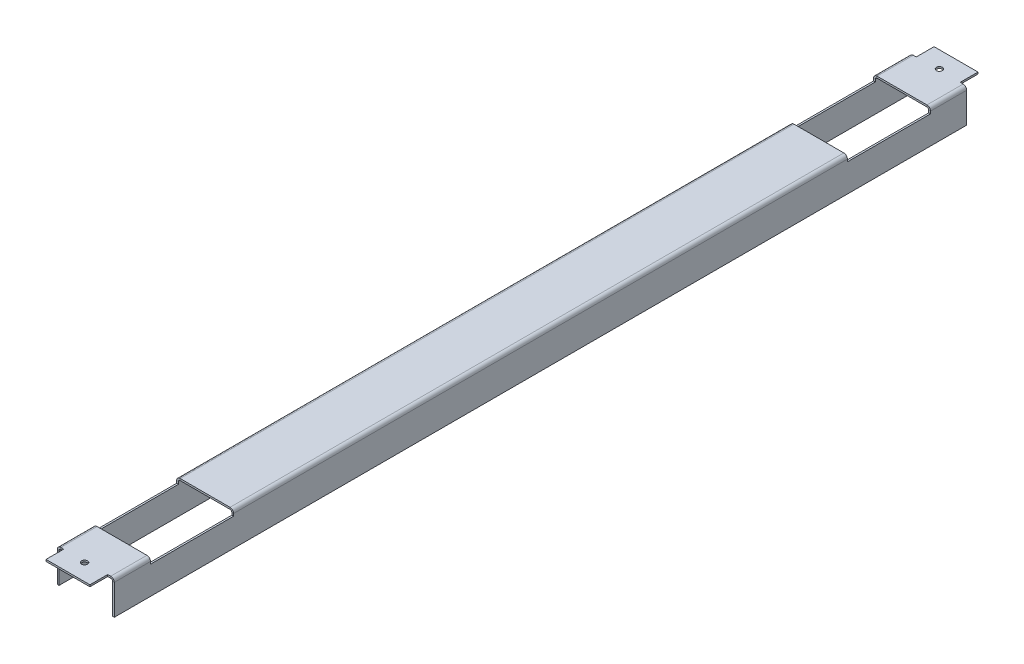
from build123d import *

# Parameters (mm, degrees)
SM_BASE_FLANGE_1_DEPTH = 374
SKETCH_6_R             = 2.5
SKETCH_6_W             = 6.5
SKETCH_6_H             = 15
CUT_EXTRUDE_1_DEPTH    = 376.851366899
SKETCH_7_W             = 50
SKETCH_7_H             = 70
CUT_EXTRUDE_2_DEPTH    = 5


# Sheet-metal steps are written as plain solids
with BuildPart() as part:
    # Sketch 1 → Базовая кромка1 (new, symmetric)
    with BuildSketch(Plane.XY):
        with BuildLine():
            Line((-22.5, -27), (-22.5, -1.5))
            ThreePointArc((-22.5, -1.5), (-22.060660172, -0.439339828), (-21, 0))
            Line((-21, 0), (21, 0))
            ThreePointArc((21, 0), (22.060660172, -0.439339828), (22.5, -1.5))
            Line((22.5, -1.5), (22.5, -27))
            Line((22.5, -27), (24, -27))
            Line((24, -27), (24, -1.5))
            ThreePointArc((24, -1.5), (23.121320344, 0.621320344), (21, 1.5))
            Line((21, 1.5), (-21, 1.5))
            ThreePointArc((-21, 1.5), (-23.121320344, 0.621320344), (-24, -1.5))
            Line((-24, -1.5), (-24, -27))
            Line((-24, -27), (-22.5, -27))
        make_face()
    extrude(amount=SM_BASE_FLANGE_1_DEPTH, both=True)

    # Эскиз6 → Вырез-Вытянуть1 (cut, through all)
    with BuildSketch(Plane(origin=(0, 1.5, 0), x_dir=(1, 0, 0), z_dir=(0, 1, 0))):
        with Locations(Location((0, -360, 0), (0, 0, 180))):
            Circle(SKETCH_6_R)
        with Locations((0, 360)):
            Circle(SKETCH_6_R)
        with Locations((-21.75, -366.5)):
            Rectangle(SKETCH_6_W, SKETCH_6_H)
        with Locations((21.75, -366.5)):
            Rectangle(SKETCH_6_W, SKETCH_6_H)
        with Locations((21.75, 366.5)):
            Rectangle(SKETCH_6_W, SKETCH_6_H)
        with Locations((-21.75, 366.5)):
            Rectangle(SKETCH_6_W, SKETCH_6_H)
    extrude(amount=-CUT_EXTRUDE_1_DEPTH, mode=Mode.SUBTRACT)

    # Эскиз7 → Вырез-Вытянуть2 (cut)
    with BuildSketch(Plane(origin=(0, 1.5, 0), x_dir=(1, 0, 0), z_dir=(0, 1, 0))):
        with Locations((0, -293.5)):
            Rectangle(SKETCH_7_W, SKETCH_7_H)
        with Locations((0, 293.5)):
            Rectangle(SKETCH_7_W, SKETCH_7_H)
    extrude(amount=-CUT_EXTRUDE_2_DEPTH, mode=Mode.SUBTRACT)


solid = part.part
